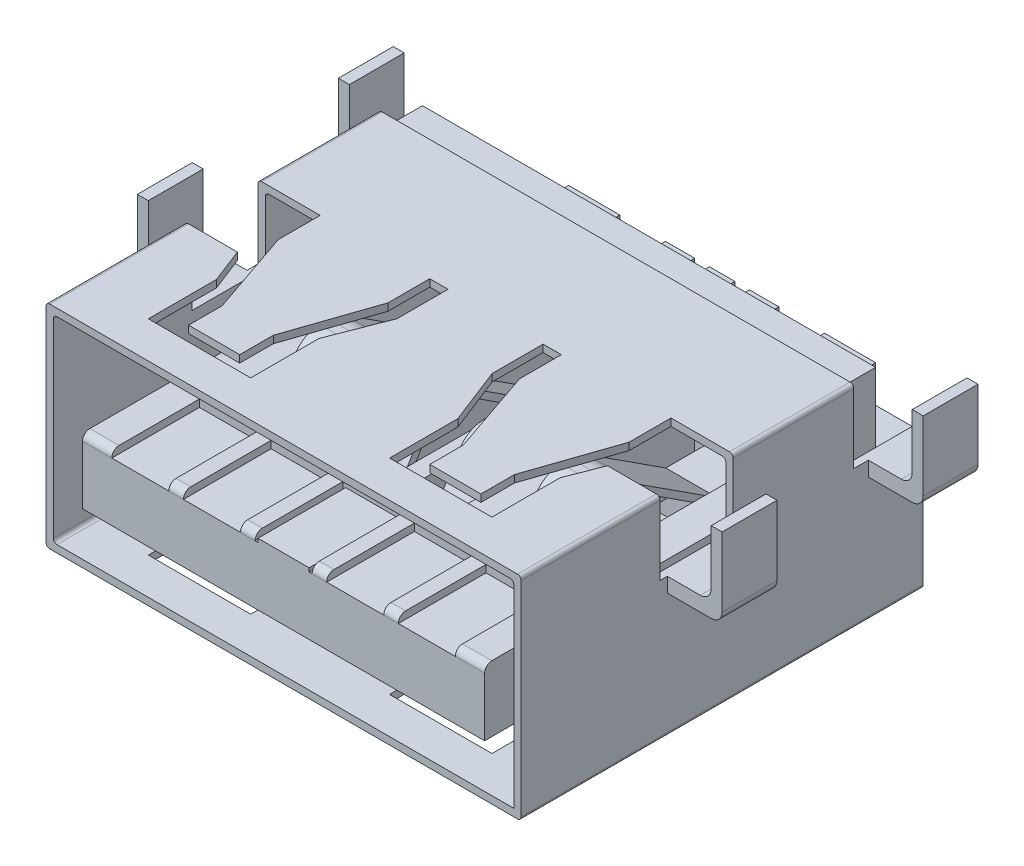
from build123d import *

# Parameters (mm, degrees)
EXTRUDE_1_DEPTH      = 12.4
SKETCH_2_W           = 1.2
SKETCH_2_H           = 5.8
SKETCH_2_W_2         = 0.7
SKETCH_2_H_2         = 9
SKETCH_2_W_3         = 2.25
CUT_EXTRUDE_1_DEPTH  = 16.612815249
FILLET_1_R           = 0.2
SKETCH_3_W           = 1.56
SKETCH_3_H           = 2.4
CUT_EXTRUDE_2_DEPTH  = 0.2
SKETCH_4_W           = 1.4
SKETCH_4_H           = 2.4
EXTRUDE_2_DEPTH      = 0.1
EXTRUDE_3_DEPTH      = 1.4
EXTRUDE_4_DEPTH      = 0.8
EXTRUDE_5_DEPTH      = 0.8
EXTRUDE_6_DEPTH      = 1.4
FILLET_2_R           = 0.8
EXTRUDE_7_DEPTH      = 0.01
EXTRUDE_7_DEPTH_BACK = 0.2
SKETCH_10_W          = 1.4
SKETCH_10_H          = 2
SKETCH_10_W_2        = 0.8
SKETCH_10_W_3        = 0.7
SKETCH_11_W          = 13
SKETCH_11_H          = 5.8
SKETCH_11_W_2        = 12.6
SKETCH_11_H_2        = 5.4
EXTRUDE_8_DEPTH      = 11
FILLET_4_R           = 0.1
CUT_EXTRUDE_3_DEPTH  = 2
CUT_EXTRUDE_4_REACH  = 18.611
CUT_EXTRUDE_9_DEPTH  = 1.9
EXTRUDE_9_DEPTH      = 7
CUT_EXTRUDE_10_REACH = 19.152
SKETCH_18_W          = 1.5
SKETCH_18_H          = 4
FILLET_5_R           = 0.3


with BuildPart() as part:
    # 草图1 → 凸台-拉伸1 (new body)
    with BuildSketch(Plane(origin=(0, 0, 0), x_dir=(0, 0, -1), z_dir=(1, 0, 0))):
        Polygon((0, 0), (-9, 0), (-9, -1.8), (0, -1.8), (0, -3), (2, -3), (2, 0.5), (1, 0.5), (1, 2.4), (0, 2.4), align=None)
    extrude(amount=-EXTRUDE_1_DEPTH)

    # 草图2 → 切除-拉伸1 (cut, through all)
    with BuildSketch(Plane(origin=(0, 0, 0), x_dir=(1, 0, 0), z_dir=(0, 1, 0))):
        with Locations((-7.05, -2.9)):
            Rectangle(SKETCH_2_W, SKETCH_2_H)
        with Locations((-0.35, -4.5)):
            Rectangle(SKETCH_2_W_2, SKETCH_2_H_2)
        with Locations((-2.825, -2.9)):
            Rectangle(SKETCH_2_W_3, SKETCH_2_H)
        with Locations((-5.35, -2.9)):
            Rectangle(SKETCH_2_W, SKETCH_2_H)
        with Locations((-9.575, -2.9)):
            Rectangle(SKETCH_2_W_3, SKETCH_2_H)
        with Locations((-12.05, -4.5)):
            Rectangle(SKETCH_2_W_2, SKETCH_2_H_2)
    extrude(amount=-CUT_EXTRUDE_1_DEPTH, mode=Mode.SUBTRACT)

    # 圆角1
    fillet_1_edges = [part.edges().sort_by_distance(p)[0] for p in [
        (-6.2, 0, 9),
    ]]
    fillet(fillet_1_edges, radius=FILLET_1_R)

    # 草图3 → 切除-拉伸2 (cut)
    with BuildSketch(Plane(origin=(0, 0, 0), x_dir=(1, 0, 0), z_dir=(0, 1, 0))):
        with Locations((-2.28, -7.8)):
            Rectangle(SKETCH_3_W, SKETCH_3_H)
        with Locations((-4.24, -7.8)):
            Rectangle(SKETCH_3_W, SKETCH_3_H)
        with Locations((-6.2, -7.8)):
            Rectangle(SKETCH_3_W, SKETCH_3_H)
        with Locations((-10.12, -7.8)):
            Rectangle(SKETCH_3_W, SKETCH_3_H)
        with Locations((-8.16, -7.8)):
            Rectangle(SKETCH_3_W, SKETCH_3_H)
    extrude(amount=-CUT_EXTRUDE_2_DEPTH, mode=Mode.SUBTRACT)

    # 草图4 → 凸台-拉伸2 (add)
    with BuildSketch(Plane(origin=(0, -0.2, 0), x_dir=(1, 0, 0), z_dir=(0, 1, 0))):
        with Locations((-6.2, -7.8)):
            Rectangle(SKETCH_4_W, SKETCH_4_H)
    extrude(amount=EXTRUDE_2_DEPTH)

    # 草图5 → 凸台-拉伸3 (add)
    with BuildSketch(Plane(origin=(-3.6, 0, 0), x_dir=(0, 0, -1), z_dir=(1, 0, 0))):
        Polygon((-5.564586627, -0.999282589), (-4.46393695, 0.8241818), (-3.522393596, 0.8241818), (-1.142420407, -0.713143689), (0, -0.713143689), (0, -0.897413393), (-1.179015361, -0.897413393), (-3.460964996, 0.576594532), (-4.379371234, 0.576594532), (-5.330576343, -0.999282589), align=None)
    extrude(amount=EXTRUDE_3_DEPTH)

    # 草图6 → 凸台-拉伸4 (add)
    with BuildSketch(Plane(origin=(-5.7, 0, 0), x_dir=(0, 0, -1), z_dir=(1, 0, 0))):
        Polygon((-5.564586627, -0.999282589), (-4.46393695, 0.8241818), (-3.522393596, 0.8241818), (-1.142420407, -0.713143689), (0, -0.713143689), (0, -0.9), (-1.179015361, -0.897413393), (-3.460964996, 0.576594532), (-4.379371234, 0.576594532), (-5.330576343, -0.999282589), align=None)
    extrude(amount=EXTRUDE_4_DEPTH)

    # 草图8 → 凸台-拉伸5 (add)
    with BuildSketch(Plane(origin=(-7.5, 0, 0), x_dir=(0, 0, -1), z_dir=(1, 0, 0))):
        Polygon((-5.564586627, -0.999282589), (-4.46393695, 0.8241818), (-3.522393596, 0.8241818), (-1.142420407, -0.713143689), (0, -0.713143689), (0, -0.897413393), (-1.179015361, -0.897413393), (-3.460964996, 0.576594532), (-4.379371234, 0.576594532), (-5.330576343, -0.999282589), align=None)
    extrude(amount=EXTRUDE_5_DEPTH)

    # 草图9 → 凸台-拉伸6 (add)
    with BuildSketch(Plane(origin=(-10.2, 0, 0), x_dir=(0, 0, -1), z_dir=(1, 0, 0))):
        Polygon((-5.564586627, -0.999282589), (-4.46393695, 0.8241818), (-3.522393596, 0.8241818), (-1.142420407, -0.713143689), (0, -0.713143689), (0, -0.9), (-1.179015361, -0.897413393), (-3.460964996, 0.576594532), (-4.379371234, 0.576594532), (-5.330576343, -0.999282589), align=None)
    extrude(amount=EXTRUDE_6_DEPTH)

    # 圆角2
    fillet_2_edges = [part.edges().sort_by_distance(p)[0] for p in [
        (-2.9, 0.576594532, 4.379371234),
        (-2.9, 0.576594532, 3.460964996),
        (-2.9, 0.8241818, 3.522393596),
        (-2.9, 0.8241818, 4.46393695),
        (-5.3, 0.576594532, 4.379371234),
        (-5.3, 0.576594532, 3.460964996),
        (-5.3, 0.8241818, 3.522393596),
        (-5.3, 0.8241818, 4.46393695),
        (-7.1, 0.576594532, 4.379371234),
        (-7.1, 0.576594532, 3.460964996),
        (-7.1, 0.8241818, 3.522393596),
        (-7.1, 0.8241818, 4.46393695),
        (-9.5, 0.576594532, 4.379371234),
        (-9.5, 0.576594532, 3.460964996),
        (-9.5, 0.8241818, 3.522393596),
        (-9.5, 0.8241818, 4.46393695),
    ]]
    fillet(fillet_2_edges, radius=FILLET_2_R)

    # 草图10 → 凸台-拉伸7 (add, two sides: drawn at the far end of the back side and taken through both)
    with BuildSketch(Plane(origin=(0, 0.5, 0), x_dir=(1, 0, 0), z_dir=(0, 1, 0)).offset(-EXTRUDE_7_DEPTH_BACK)):
        with Locations((-2.7, 2)):
            Rectangle(SKETCH_10_W, SKETCH_10_H)
        with Locations((-7.35, 2)):
            Rectangle(SKETCH_10_W_2, SKETCH_10_H)
        with Locations((-5.05, 2)):
            Rectangle(SKETCH_10_W_2, SKETCH_10_H)
        with Locations((-6.2, 2)):
            Rectangle(SKETCH_10_W_3, SKETCH_10_H)
        with Locations((-9.7, 2)):
            Rectangle(SKETCH_10_W, SKETCH_10_H)
    extrude(amount=EXTRUDE_7_DEPTH + EXTRUDE_7_DEPTH_BACK)

    # 草图11 → 凸台-拉伸8 (add)
    with BuildSketch(Plane.XY.offset(9)):
        with Locations((-6.2, -0.3)):
            Rectangle(SKETCH_11_W, SKETCH_11_H)
        with Locations((-6.2, -0.3)):
            Rectangle(SKETCH_11_W_2, SKETCH_11_H_2, mode=Mode.SUBTRACT)
    extrude(amount=-EXTRUDE_8_DEPTH)

    # 圆角4
    fillet_4_edges = [part.edges().sort_by_distance(p)[0] for p in [
        (-12.5, -3, 3.5),
        (-12.7, -3.2, 3.5),
        (0.3, -3.2, 3.5),
        (0.3, 2.6, 3.5),
        (0.1, 2.4, 3.5),
        (-12.5, 2.4, 3.5),
        (-12.7, 2.6, 3.5),
    ]]
    fillet(fillet_4_edges, radius=FILLET_4_R - 0.0001)  # a hair under: the kernel refuses the full size

    # 草图12 → 切除-拉伸3 (cut)
    with BuildSketch(Plane(origin=(0, 2.6, 0), x_dir=(1, 0, 0), z_dir=(0, 1, 0))):
        Polygon((-1.4, -3.2), (-1.4, -4.344388127), (-2.2, -6.681014455), (-2.2, -7.6), (-3.6, -7.6), (-3.6, -6.681014455), (-4.4, -4.344388127), (-4.4, -3.2), (-4.9, -3.2), (-4.9, -4.593296814), (-4.3, -6.133585062), (-4.3, -8), (-1.5, -8), (-1.5, -6.133585062), (-1.136333629, -5.2), (0.3, -5.2), (0.3, -3.2), (-0.9, -3.2), align=None)
        Polygon((-12.7, -3.2), (-12.7, -5.2), (-11.263666371, -5.2), (-10.9, -6.133585062), (-10.9, -8), (-8.1, -8), (-8.1, -6.133585062), (-7.5, -4.593296814), (-7.5, -3.2), (-8, -3.2), (-8, -4.344388127), (-8.8, -6.681014455), (-8.8, -7.6), (-10.2, -7.6), (-10.2, -6.681014455), (-11, -4.344388127), (-11, -3.2), (-11.5, -3.2), align=None)
    extrude(amount=-CUT_EXTRUDE_3_DEPTH, mode=Mode.SUBTRACT)

    # 草图13 → 切除-拉伸4 (cut, up to next)
    with BuildSketch(Plane.XZ.offset(3.2), mode=Mode.PRIVATE) as cut_extrude_4_sk1:
        Polygon((-1.4, 3.2), (-0.9, 3.2), (-0.9, 4.593296814), (-1.5, 6.133585062), (-1.5, 8), (-4.3, 8), (-4.3, 6.133585062), (-4.9, 4.593296814), (-4.9, 3.2), (-4.4, 3.2), (-4.4, 4.344388127), (-3.6, 6.681014455), (-3.6, 7.6), (-2.2, 7.6), (-2.2, 6.681014455), (-1.4, 4.344388127), align=None)
    cut_extrude_4_tool1 = extrude(cut_extrude_4_sk1.sketch, amount=-CUT_EXTRUDE_4_REACH, mode=Mode.PRIVATE) & part.part
    # 草图13 → 切除-拉伸4 (cut, up to next)
    with BuildSketch(Plane.XZ.offset(3.2), mode=Mode.PRIVATE) as cut_extrude_4_sk2:
        Polygon((-11, 4.344388127), (-11, 3.2), (-11.5, 3.2), (-11.5, 4.593296814), (-10.9, 6.133585062), (-10.9, 8), (-8.1, 8), (-8.1, 6.133585062), (-7.5, 4.593296814), (-7.5, 3.2), (-8, 3.2), (-8, 4.344388127), (-8.8, 6.681014455), (-8.8, 7.6), (-10.2, 7.6), (-10.2, 6.681014455), align=None)
    cut_extrude_4_tool2 = extrude(cut_extrude_4_sk2.sketch, amount=-CUT_EXTRUDE_4_REACH, mode=Mode.PRIVATE) & part.part
    add(cut_extrude_4_tool1.solids().sort_by_distance((-1.15, -3.2, 3.262482))[0], mode=Mode.SUBTRACT)
    add(cut_extrude_4_tool2.solids().sort_by_distance((-11.062482, -3.2, 3.772194))[0], mode=Mode.SUBTRACT)

    # 草图16 → 切除-拉伸9 (cut)
    with BuildSketch(Plane(origin=(0, 0, -2), x_dir=(-1, 0, 0), z_dir=(0, 0, -1))):
        Polygon((-0.3, 0.6), (0, 0.6), (0, 2.4), (12.4, 2.4), (12.4, 0.6), (12.7, 0.6), (12.7, 2.631840107), (-0.3, 2.631840107), align=None)
    extrude(amount=-CUT_EXTRUDE_9_DEPTH, mode=Mode.SUBTRACT)

    # 草图17 → 凸台-拉伸9 (add)
    with BuildSketch(Plane(origin=(0, 0, -2), x_dir=(-1, 0, 0), z_dir=(0, 0, -1))):
        Polygon((-0.1, 0.6), (-1.5, 0.6), (-1.5, 2.4), (-1.8, 2.4), (-1.8, 0.2), (-0.1, 0.2), align=None)
        Polygon((12.5, 0.2), (12.5, 0.6), (13.9, 0.6), (13.9, 2.4), (14.2, 2.4), (14.2, 0.2), align=None)
    extrude(amount=-EXTRUDE_9_DEPTH)

    # 切除-拉伸10: up to this face of the body (flat: up to its plane)
    cut_extrude_10_end = Plane(part.part.faces().sort_by_distance((-14.05, 2.4, 1.5))[0])
    # 草图18 → 切除-拉伸10 (cut, up to the picked face)
    with BuildSketch(Plane.XZ.offset(-0.2), mode=Mode.PRIVATE) as cut_extrude_10_sk1:
        with Locations((1.05, 1.5)):
            Rectangle(SKETCH_18_W, SKETCH_18_H)
    cut_extrude_10_tool1 = split(extrude(cut_extrude_10_sk1.sketch, amount=-CUT_EXTRUDE_10_REACH, mode=Mode.PRIVATE), bisect_by=cut_extrude_10_end, keep=Keep.BOTH, mode=Mode.PRIVATE)
    # 草图18 → 切除-拉伸10 (cut, up to the picked face)
    with BuildSketch(Plane.XZ.offset(-0.2), mode=Mode.PRIVATE) as cut_extrude_10_sk2:
        with Locations((-13.45, 1.5)):
            Rectangle(SKETCH_18_W, SKETCH_18_H)
    cut_extrude_10_tool2 = split(extrude(cut_extrude_10_sk2.sketch, amount=-CUT_EXTRUDE_10_REACH, mode=Mode.PRIVATE), bisect_by=cut_extrude_10_end, keep=Keep.BOTH, mode=Mode.PRIVATE)
    add(cut_extrude_10_tool1.solids().sort_by(Axis((1.05, 0.2, 1.5), (0, 1, 0)))[0], mode=Mode.SUBTRACT)
    add(cut_extrude_10_tool2.solids().sort_by(Axis((-13.45, 0.2, 1.5), (0, 1, 0)))[0], mode=Mode.SUBTRACT)

    # 圆角5
    fillet_5_edges = [part.edges().sort_by_distance(p)[0] for p in [
        (1.5, 0.6, 4.25),
        (1.8, 0.2, 4.25),
        (-14.2, 0.2, 4.25),
        (-13.9, 0.6, 4.25),
        (-14.2, 0.2, -1.25),
        (-13.9, 0.6, -1.25),
        (1.5, 0.6, -1.25),
        (1.8, 0.2, -1.25),
    ]]
    fillet(fillet_5_edges, radius=FILLET_5_R)


solid = part.part
